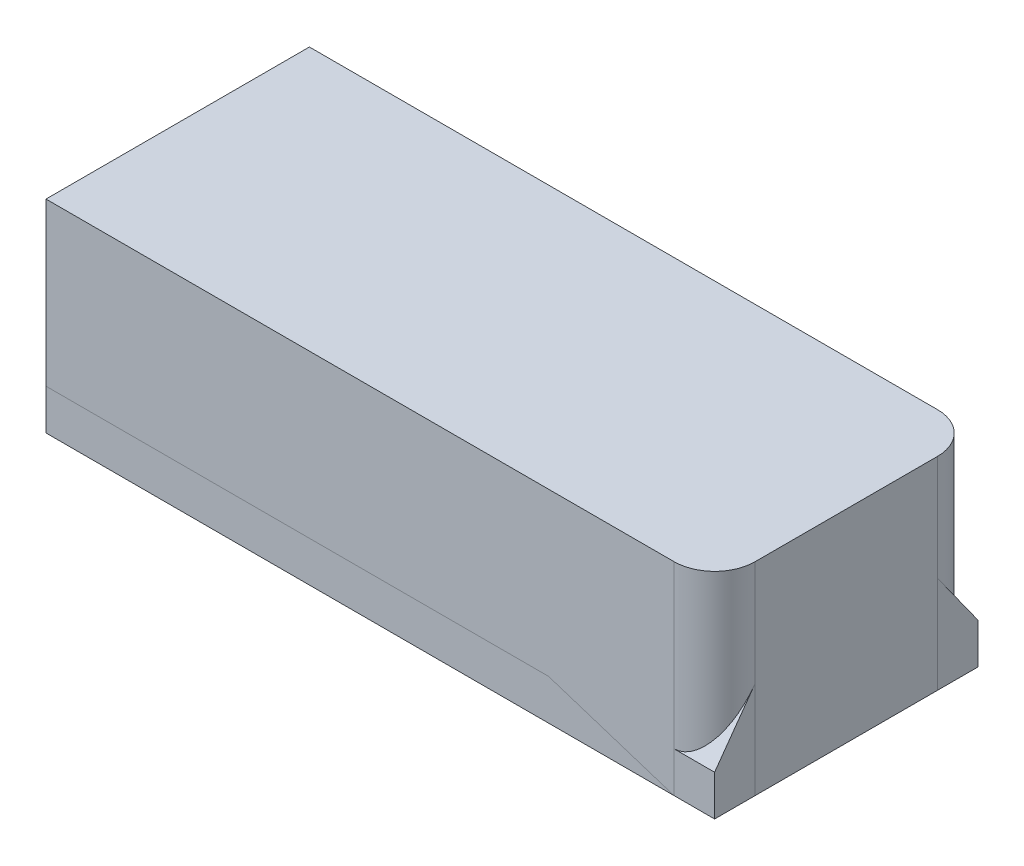
from build123d import *

# Parameters (mm, degrees)
BOSS_EXTRUDE1_DEPTH      = 15.875
BOSS_EXTRUDE2_DEPTH      = 10.31875
BOSS_EXTRUDE2_DEPTH_BACK = 10.31875
SKETCH3_R                = 0.79375
BOSS_EXTRUDE3_DEPTH      = 52.3875


with BuildPart() as part:
    # Sketch1 → Boss-Extrude1 (new body)
    with BuildSketch(Plane(origin=(0, 0, 0), x_dir=(1, 0, 0), z_dir=(0, 1, 0))):
        with BuildLine():
            Line((0, -10.31875), (0, 10.31875))
            Line((0, 10.31875), (49.2125, 10.31875))
            ThreePointArc((49.2125, 10.31875), (51.45756403, 9.38881403), (52.3875, 7.14375))
            Line((52.3875, 7.14375), (52.3875, -7.14375))
            ThreePointArc((52.3875, -7.14375), (51.45756403, -9.38881403), (49.2125, -10.31875))
            Line((49.2125, -10.31875), (0, -10.31875))
        make_face()
    extrude(amount=BOSS_EXTRUDE1_DEPTH)


with BuildPart() as body_2:
    # Sketch2 → Boss-Extrude2 (new, two sides: drawn at the far end of the back side and taken through both)
    with BuildSketch(Plane.XY.offset(-BOSS_EXTRUDE2_DEPTH_BACK)):
        Polygon((0, 0), (0, 3.175), (1.5875, 3.175), (1.5875, 15.875), (4.7625, 15.875), (4.7625, 3.175), (9.525, 3.175), (9.525, 15.875), (12.7, 15.875), (12.7, 3.175), (52.3875, 3.175), (52.3875, 0), align=None)
    extrude(amount=BOSS_EXTRUDE2_DEPTH + BOSS_EXTRUDE2_DEPTH_BACK)


with BuildPart() as body_3:
    # Sketch3 → Boss-Extrude3 (new body)
    with BuildSketch(Plane(origin=(0, 0, 0), x_dir=(0, 0, -1), z_dir=(1, 0, 0))):
        with BuildLine():
            Line((10.31875, 0), (-10.31875, 0))
            Line((-10.31875, 0), (-10.31875, 3.175))
            Line((-10.31875, 3.175), (-1.93598896, 14.880219729))
            ThreePointArc((-1.93598896, 14.880219729), (0, 15.875), (1.93598896, 14.880219729))
            Line((1.93598896, 14.880219729), (10.31875, 3.175))
            Line((10.31875, 3.175), (10.31875, 0))
        make_face()
        with Locations((0, 13.49375)):
            Circle(SKETCH3_R, mode=Mode.SUBTRACT)
    extrude(amount=BOSS_EXTRUDE3_DEPTH)


solid = Compound([part.part, body_2.part, body_3.part])
